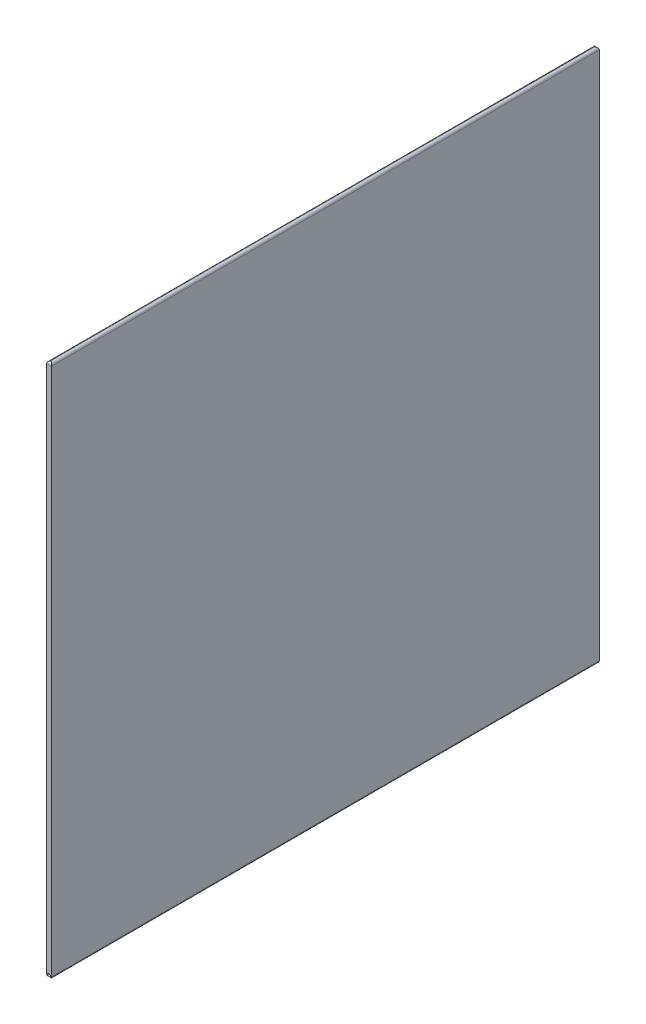
from build123d import *

# Parameters (mm, degrees)
SKETCH_1_W          = 343
SKETCH_1_H          = 334
EXTRUDE_1_DEPTH     = 3
SKETCH_3_R          = 1
CUT_EXTRUDE_1_DEPTH = 382.506225375
FILLET_1_R          = 1.5
FILLET_2_R          = 1.5


# Some blends are built 0.0001 mm under size
with BuildPart() as part:
    # 草图1 → 凸台-拉伸1 (new body)
    with BuildSketch(Plane(origin=(0, 0, 0), x_dir=(0, 0, -1), z_dir=(1, 0, 0))):
        Rectangle(SKETCH_1_W, SKETCH_1_H)
    extrude(amount=EXTRUDE_1_DEPTH)

    # 草图3 → 切除-拉伸1 (cut, through all)
    with BuildSketch(Plane.XY.offset(171.5)):
        with Locations((1.5, -165.5)):
            Circle(SKETCH_3_R)
    extrude(amount=-CUT_EXTRUDE_1_DEPTH, mode=Mode.SUBTRACT)

    # 圆角1
    # the kernel refuses this fillet: 1.5 mm, written as the material it takes off along each edge
    with BuildSketch(Plane(origin=(3, -167, -175.25), x_dir=(0, 1, 0), z_dir=(0, 0, 1))) as fillet_1_piece_1:
        with BuildLine():
            CenterArc((FILLET_1_R, FILLET_1_R), FILLET_1_R, 180, 90)
            Line((0, FILLET_1_R), (0, 0))
            Line((0, 0), (FILLET_1_R, 0))
        make_face()
    extrude(amount=350.5, mode=Mode.SUBTRACT)
    with BuildSketch(Plane(origin=(0, -167, -175.25), x_dir=(0, 1, 0), z_dir=(0, 0, 1))) as fillet_1_piece_2:
        with BuildLine():
            CenterArc((FILLET_1_R, -FILLET_1_R), FILLET_1_R, 90, 90)
            Line((0, -FILLET_1_R), (0, 0))
            Line((0, 0), (FILLET_1_R, 0))
        make_face()
    extrude(amount=350.5, mode=Mode.SUBTRACT)
    with BuildSketch(Plane(origin=(-3.75, -167, -171.5), x_dir=(0, 1, 0), z_dir=(1, 0, 0))) as fillet_1_piece_3:
        with BuildLine():
            CenterArc((FILLET_1_R, FILLET_1_R), FILLET_1_R, 180, 90)
            Line((0, FILLET_1_R), (0, 0))
            Line((0, 0), (FILLET_1_R, 0))
        make_face()
    extrude(amount=10.5, mode=Mode.SUBTRACT)
    with BuildSketch(Plane(origin=(-3.75, -167, 171.5), x_dir=(0, 1, 0), z_dir=(1, 0, 0))) as fillet_1_piece_4:
        with BuildLine():
            CenterArc((FILLET_1_R, -FILLET_1_R), FILLET_1_R, 90, 90)
            Line((0, -FILLET_1_R), (0, 0))
            Line((0, 0), (FILLET_1_R, 0))
        make_face()
    extrude(amount=10.5, mode=Mode.SUBTRACT)

    # 圆角2
    fillet_2_edges = [part.edges().sort_by_distance(p)[0] for p in [
        (0, 167, 0),
        (3, 167, 0),
        (1.5, 167, 171.5),
        (1.5, 167, -171.5),
    ]]
    fillet(fillet_2_edges, radius=FILLET_2_R - 0.0001)  # a hair under: the kernel refuses the full size


solid = part.part
